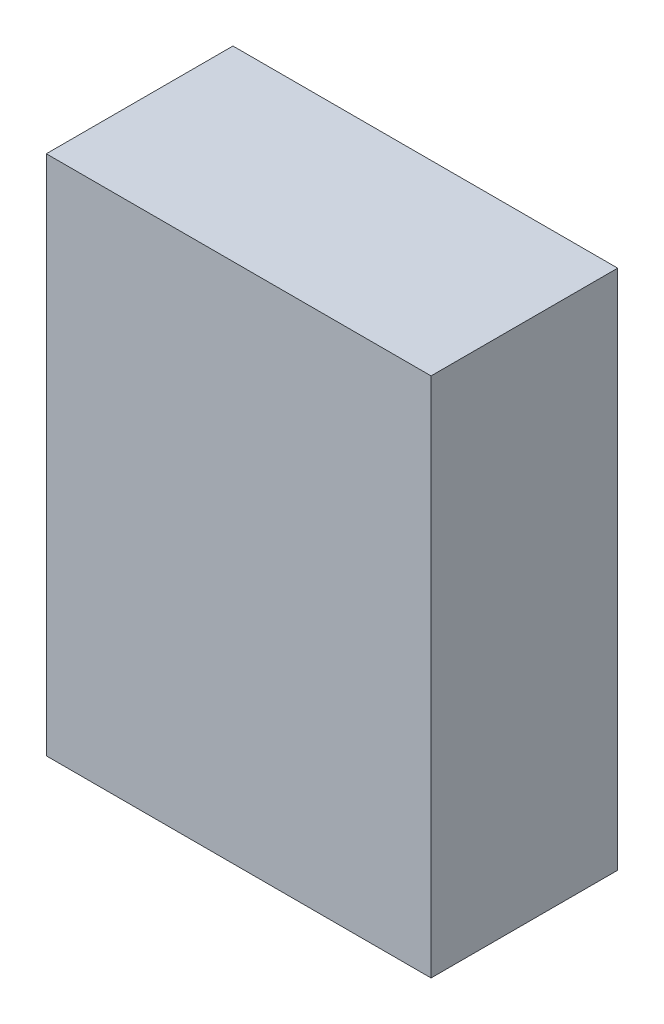
from build123d import *

# Parameters (mm, degrees)
SKIZZE1_W                       = 20.615840772
SKIZZE1_H                       = 27.939889468
AUFSATZ_LINEAR_AUSTRAGEN1_DEPTH = 10


with BuildPart() as part:
    # Skizze1 → Aufsatz-Linear austragen1 (new body)
    with BuildSketch(Plane.XY):
        with Locations((10.307920386, -13.969944734)):
            Rectangle(SKIZZE1_W, SKIZZE1_H)
    extrude(amount=AUFSATZ_LINEAR_AUSTRAGEN1_DEPTH)


solid = part.part
